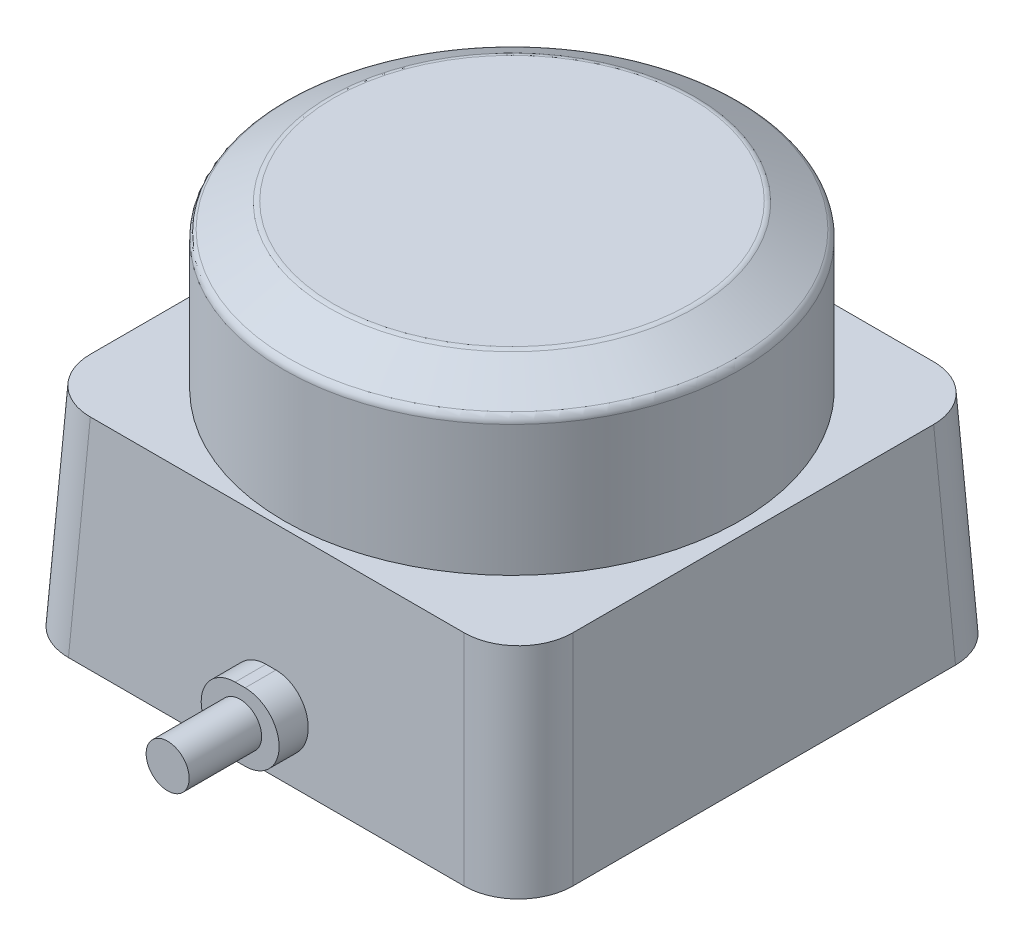
from build123d import *

# Parameters (mm, degrees)
SKETCH1_W           = 55.65
SKETCH1_H           = 54.22051571
BOSS_EXTRUDE1_DEPTH = 23
BOSS_EXTRUDE1_TAPER = 3
SKETCH2_R           = 25.15
BOSS_EXTRUDE2_DEPTH = 18
CHAMFER1_SIZE       = 3
CHAMFER1_SIZE2      = 5.196152423
BOSS_EXTRUDE3_DEPTH = 30
SKETCH4_R           = 2.375
BOSS_EXTRUDE4_DEPTH = 8
SKETCH5_R           = 1.25
CUT_EXTRUDE1_DEPTH  = 5
CHAMFER2_SIZE       = 0.2
CHAMFER2_SIZE2      = 0.346410162
FILLET1_R           = 6
FILLET2_R           = 1


with BuildPart() as part:
    # Sketch1 → Boss-Extrude1 (new body)
    with BuildSketch(Plane(origin=(0, 0, 0), x_dir=(1, 0, 0), z_dir=(0, 1, 0))):
        Rectangle(SKETCH1_W, SKETCH1_H)
    extrude(amount=BOSS_EXTRUDE1_DEPTH, taper=BOSS_EXTRUDE1_TAPER)

    # Sketch2 → Boss-Extrude2 (add)
    with BuildSketch(Plane(origin=(0, 23, 0), x_dir=(1, 0, 0), z_dir=(0, 1, 0))):
        Circle(SKETCH2_R)
    extrude(amount=BOSS_EXTRUDE2_DEPTH)

    # Chamfer1
    chamfer1_edges = [part.edges().sort_by_distance(p)[0] for p in [
        (-25.15, 41, 0),
    ]]
    chamfer1_side = [part.faces().sort_by_distance(p)[0] for p in [
        (-25.15, 32, 0),
    ]]
    chamfer(chamfer1_edges, length=CHAMFER1_SIZE, length2=CHAMFER1_SIZE2, reference=chamfer1_side[0])

    # Sketch3 → Boss-Extrude3 (add)
    with BuildSketch(Plane.XY):
        with BuildLine():
            Line((0.55, 2.25), (-0.55, 2.25))
            ThreePointArc((-0.55, 2.25), (-4.3, 6), (-0.55, 9.75))
            Line((-0.55, 9.75), (0.55, 9.75))
            ThreePointArc((0.55, 9.75), (4.3, 6), (0.55, 2.25))
        make_face()
    extrude(amount=BOSS_EXTRUDE3_DEPTH)

    # Sketch4 → Boss-Extrude4 (add)
    with BuildSketch(Plane.XY.offset(30)):
        with Locations((0, 6)):
            Circle(SKETCH4_R)
    extrude(amount=BOSS_EXTRUDE4_DEPTH)

    # Sketch5 → Cut-Extrude1 (cut)
    with BuildSketch(Plane.XZ):
        with Locations((-21.4, 21.4)):
            Circle(SKETCH5_R)
        with Locations((21.4, 21.4)):
            Circle(SKETCH5_R)
        with Locations((21.4, -21.4)):
            Circle(SKETCH5_R)
        with Locations((-21.4, -21.4)):
            Circle(SKETCH5_R)
    extrude(amount=-CUT_EXTRUDE1_DEPTH, mode=Mode.SUBTRACT)

    # Chamfer2
    chamfer2_edges = [part.edges().sort_by_distance(p)[0] for p in [
        (-22.65, 0, 21.4),
        (20.15, 0, -21.4),
        (-22.65, 0, -21.4),
        (20.15, 0, 21.4),
    ]]
    chamfer2_side = [part.faces().sort_by_distance(p)[0] for p in [
        (0, 0, 0),
    ]]
    chamfer(chamfer2_edges, length=CHAMFER2_SIZE, length2=CHAMFER2_SIZE2, reference=chamfer2_side[0])

    # Fillet1
    fillet1_edges = [part.edges().sort_by_distance(p)[0] for p in [
        (-27.222310538, 11.5, 26.507568393),
        (-27.222310538, 11.5, -26.507568393),
        (27.222310538, 11.5, -26.507568393),
        (27.222310538, 11.5, 26.507568393),
    ]]
    fillet(fillet1_edges, radius=FILLET1_R)

    # Fillet2
    fillet2_edges = [part.edges().sort_by_distance(p)[0] for p in [
        (-19.953847577, 41, 0),
        (-25.15, 38, 0),
    ]]
    fillet(fillet2_edges, radius=FILLET2_R)


solid = part.part
